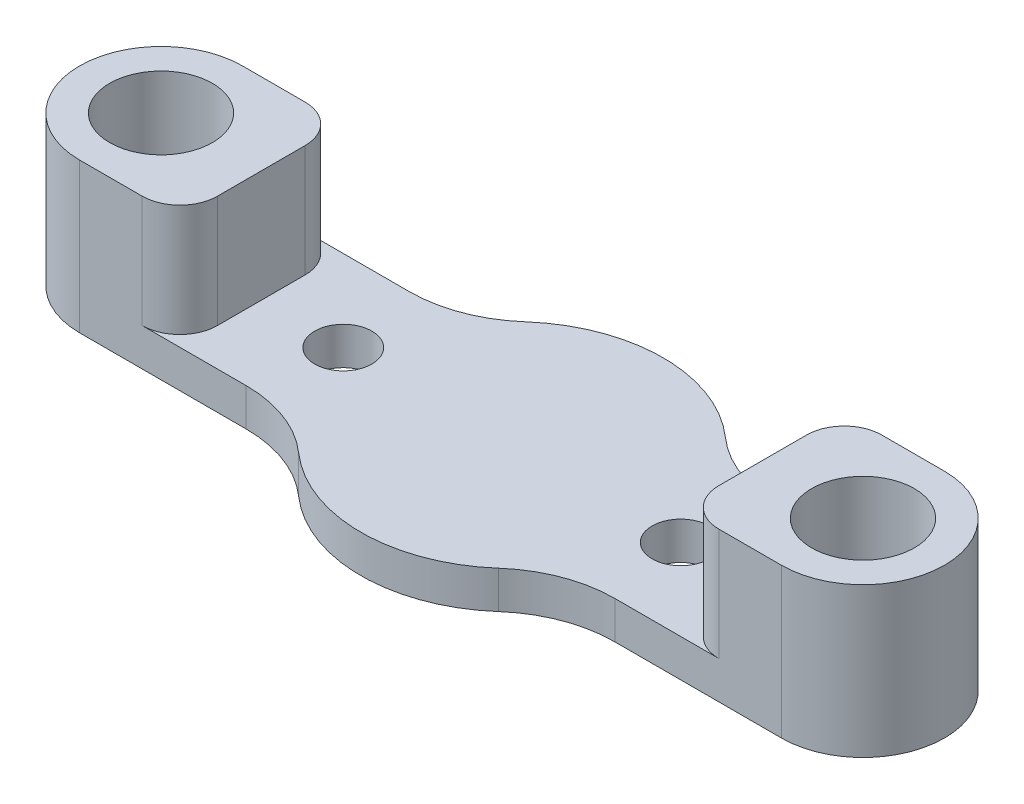
from build123d import *

# Parameters (mm, degrees)
SKETCH1_R           = 1.14
SKETCH1_R_2         = 2.05
BOSS_EXTRUDE2_DEPTH = 1.5
SKETCH2_R           = 2.05
BOSS_EXTRUDE3_DEPTH = 4.47
FILLET1_R           = 1.5


with BuildPart() as part:
    # Sketch1 → Boss-Extrude2 (new body)
    with BuildSketch(Plane(origin=(0, 0, 0), x_dir=(1, 0, 0), z_dir=(0, 1, 0))):
        with BuildLine():
            Line((-7.351408028, 3.25), (-14, 3.25))
            ThreePointArc((-14, 3.25), (-17.25, 0), (-14, -3.25))
            Line((-14, -3.25), (-7.351408028, -3.25))
            ThreePointArc((-7.351408028, -3.25), (-5.554548682, -3.578400639), (-3.990008138, -4.521143114))
            ThreePointArc((-3.990008138, -4.521143114), (0, -6.03), (3.990008138, -4.521143114))
            ThreePointArc((3.990008138, -4.521143114), (5.554548682, -3.578400639), (7.351408028, -3.25))
            Line((7.351408028, -3.25), (14, -3.25))
            ThreePointArc((14, -3.25), (17.25, 0), (14, 3.25))
            Line((14, 3.25), (7.351408028, 3.25))
            ThreePointArc((7.351408028, 3.25), (5.554548682, 3.578400639), (3.990008138, 4.521143114))
            ThreePointArc((3.990008138, 4.521143114), (0, 6.03), (-3.990008138, 4.521143114))
            ThreePointArc((-3.990008138, 4.521143114), (-5.554548682, 3.578400639), (-7.351408028, 3.25))
        make_face()
        with Locations((-6.73, 0)):
            Circle(SKETCH1_R, mode=Mode.SUBTRACT)
        with Locations((-14, 0)):
            Circle(SKETCH1_R_2, mode=Mode.SUBTRACT)
        with Locations((6.73, 0)):
            Circle(SKETCH1_R, mode=Mode.SUBTRACT)
        with Locations((14, 0)):
            Circle(SKETCH1_R_2, mode=Mode.SUBTRACT)
    extrude(amount=BOSS_EXTRUDE2_DEPTH)

    # Sketch2 → Boss-Extrude3 (add)
    # profile 1 of 2: a face of its own
    with BuildSketch(Plane(origin=(0, 1.5, 0), x_dir=(1, 0, 0), z_dir=(0, 1, 0))):
        with BuildLine():
            Line((-14, 3.25), (-10, 3.25))
            Line((-10, 3.25), (-10, -3.25))
            Line((-10, -3.25), (-14, -3.25))
            ThreePointArc((-14, -3.25), (-17.25, 0), (-14, 3.25))
        make_face()
        with Locations((-14, 0)):
            Circle(SKETCH2_R, mode=Mode.SUBTRACT)
    # profile 2 of 2: a face of its own
    with BuildSketch(Plane(origin=(0, 1.5, 0), x_dir=(1, 0, 0), z_dir=(0, 1, 0))):
        with BuildLine():
            Line((10, -3.25), (14, -3.25))
            ThreePointArc((14, -3.25), (17.25, 0), (14, 3.25))
            Line((14, 3.25), (10, 3.25))
            Line((10, 3.25), (10, -3.25))
        make_face()
        with Locations((14, 0)):
            Circle(SKETCH2_R, mode=Mode.SUBTRACT)
    extrude(amount=BOSS_EXTRUDE3_DEPTH)

    # Fillet1
    fillet1_edges = [part.edges().sort_by_distance(p)[0] for p in [
        (10, 3.735, 3.25),
        (10, 3.735, -3.25),
        (-10, 3.735, 3.25),
        (-10, 3.735, -3.25),
    ]]
    fillet(fillet1_edges, radius=FILLET1_R)


solid = part.part
